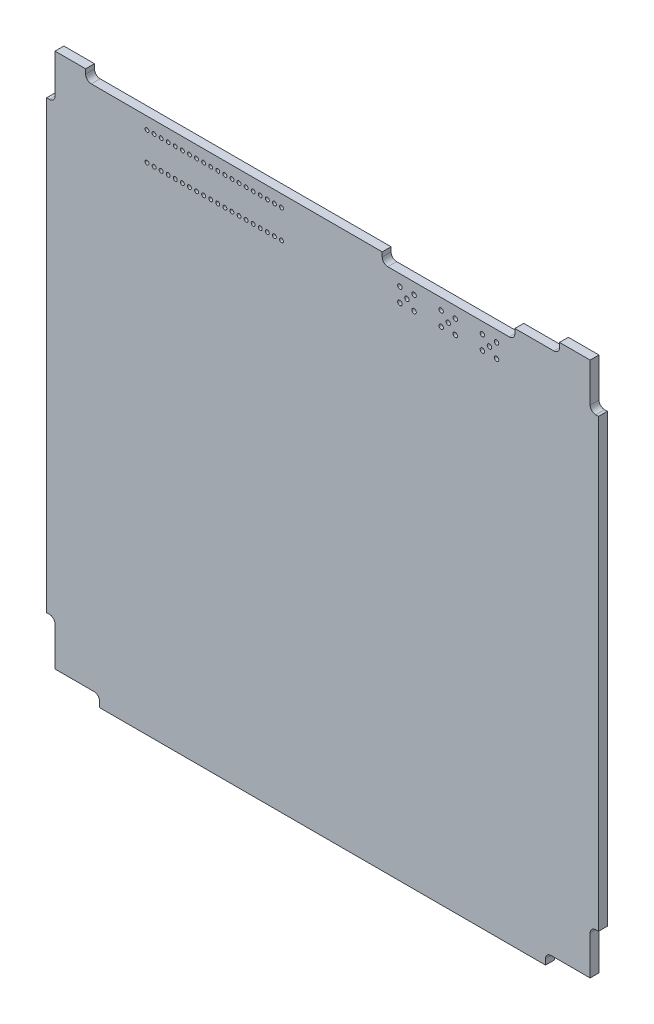
from build123d import *

# Parameters (mm, degrees)
BOSS_EXTRUDE1_DEPTH = 1.5875
SKETCH2_R           = 0.35
CUT_EXTRUDE1_DEPTH  = 71.728496069
CUT_EXTRUDE2_DEPTH  = 5.6475
FILLET2_R           = 1
SKETCH5_OUTSIDE_W   = 130.286
SKETCH5_OUTSIDE_H   = 130.286
SKETCH5_OUTSIDE_W_2 = 99
SKETCH5_OUTSIDE_H_2 = 100
CUT_EXTRUDE3_DEPTH  = 71.728496069
SKETCH8_W           = 85
SKETCH8_H           = 1.5875
CUT_EXTRUDE4_DEPTH  = 3.8375
FILLET1_R           = 1
SKETCH6_R           = 0.4
CUT_EXTRUDE5_DEPTH  = 71.375920287


with BuildPart() as part:
    # Sketch1 → Boss-Extrude1 (new body)
    with BuildSketch(Plane.XY):
        Polygon((40, 50), (-40, 50), (-40, 48), (-48, 48), (-48, 40), (-50, 40), (-50, -37.864895224), (-50, -40), (-48, -40), (-48, -48), (-40, -48), (-40, -50), (-37.864895224, -50), (40, -50), (40, -48), (48, -48), (48, -40), (50, -40), (50, 40), (48, 40), (48, 48), (40, 48), align=None)
    extrude(amount=BOSS_EXTRUDE1_DEPTH)

    # Sketch2 → Cut-Extrude1 (cut, through all)
    with BuildSketch(Plane.XY.offset(1.5875)):
        with Locations((-31.5, 44)):
            Circle(SKETCH2_R)
        with Locations((-30.23, 44)):
            Circle(SKETCH2_R)
        with Locations((-28.96, 44)):
            Circle(SKETCH2_R)
        with Locations((-27.69, 44)):
            Circle(SKETCH2_R)
        with Locations((-26.42, 44)):
            Circle(SKETCH2_R)
        with Locations((-25.15, 44)):
            Circle(SKETCH2_R)
        with Locations((-23.88, 44)):
            Circle(SKETCH2_R)
        with Locations((-22.61, 44)):
            Circle(SKETCH2_R)
        with Locations((-21.34, 44)):
            Circle(SKETCH2_R)
        with Locations((-20.07, 44)):
            Circle(SKETCH2_R)
        with Locations((-18.8, 44)):
            Circle(SKETCH2_R)
        with Locations((-17.53, 44)):
            Circle(SKETCH2_R)
        with Locations((-16.26, 44)):
            Circle(SKETCH2_R)
        with Locations((-14.99, 44)):
            Circle(SKETCH2_R)
        with Locations((-13.72, 44)):
            Circle(SKETCH2_R)
        with Locations((-12.45, 44)):
            Circle(SKETCH2_R)
        with Locations((-11.18, 44)):
            Circle(SKETCH2_R)
        with Locations((-9.91, 44)):
            Circle(SKETCH2_R)
        with Locations((-8.64, 44)):
            Circle(SKETCH2_R)
        with Locations((-7.37, 44)):
            Circle(SKETCH2_R)
        with Locations((-30.23, 38.92)):
            Circle(SKETCH2_R)
        with Locations((-28.96, 38.92)):
            Circle(SKETCH2_R)
        with Locations((-27.69, 38.92)):
            Circle(SKETCH2_R)
        with Locations((-26.42, 38.92)):
            Circle(SKETCH2_R)
        with Locations((-25.15, 38.92)):
            Circle(SKETCH2_R)
        with Locations((-23.88, 38.92)):
            Circle(SKETCH2_R)
        with Locations((-22.61, 38.92)):
            Circle(SKETCH2_R)
        with Locations((-21.34, 38.92)):
            Circle(SKETCH2_R)
        with Locations((-20.07, 38.92)):
            Circle(SKETCH2_R)
        with Locations((-18.8, 38.92)):
            Circle(SKETCH2_R)
        with Locations((-17.53, 38.92)):
            Circle(SKETCH2_R)
        with Locations((-16.26, 38.92)):
            Circle(SKETCH2_R)
        with Locations((-14.99, 38.92)):
            Circle(SKETCH2_R)
        with Locations((-13.72, 38.92)):
            Circle(SKETCH2_R)
        with Locations((-12.45, 38.92)):
            Circle(SKETCH2_R)
        with Locations((-11.18, 38.92)):
            Circle(SKETCH2_R)
        with Locations((-9.91, 38.92)):
            Circle(SKETCH2_R)
        with Locations((-8.64, 38.92)):
            Circle(SKETCH2_R)
        with Locations((-7.37, 38.92)):
            Circle(SKETCH2_R)
        with Locations((-31.5, 38.92)):
            Circle(SKETCH2_R)
    extrude(amount=-CUT_EXTRUDE1_DEPTH, mode=Mode.SUBTRACT)

    # Sketch3 → Cut-Extrude2 (cut)
    with BuildSketch(Plane(origin=(0, 50, 0), x_dir=(1, 0, 0), z_dir=(0, 1, 0))):
        Polygon((10.7, 0), (19.7, 0), (34.5, 0), (34.5, -1.5875), (19.7, -1.5875), (10.7, -1.5875), align=None)
    extrude(amount=-CUT_EXTRUDE2_DEPTH, mode=Mode.SUBTRACT)

    # Fillet2
    fillet2_edges = [part.edges().sort_by_distance(p)[0] for p in [
        (10.7, 44.3525, 0.79375),
        (34.5, 44.3525, 0.79375),
    ]]
    fillet(fillet2_edges, radius=FILLET2_R)

    # Sketch5 outside → Cut-Extrude3 (cut, through all)
    with BuildSketch(Plane(origin=(0, 0, 0), x_dir=(-1, 0, 0), z_dir=(0, 0, -1))):
        Rectangle(SKETCH5_OUTSIDE_W, SKETCH5_OUTSIDE_H)
        Rectangle(SKETCH5_OUTSIDE_W_2, SKETCH5_OUTSIDE_H_2, mode=Mode.SUBTRACT)
    extrude(amount=-CUT_EXTRUDE3_DEPTH, mode=Mode.SUBTRACT)

    # Sketch8 → Cut-Extrude4 (cut)
    with BuildSketch(Plane(origin=(0, 50, 0), x_dir=(1, 0, 0), z_dir=(0, 1, 0))):
        with Locations((0, -0.79375)):
            Rectangle(SKETCH8_W, SKETCH8_H)
    extrude(amount=-CUT_EXTRUDE4_DEPTH, mode=Mode.SUBTRACT)

    # Fillet1
    fillet1_edges = [part.edges().sort_by_distance(p)[0] for p in [
        (-48, -40, 0.79375),
        (-40, -48, 0.79375),
        (40, -48, 0.79375),
        (48, -40, 0.79375),
        (48, 40, 0.79375),
        (-48, 40, 0.79375),
        (42.5, 46.1625, 0.79375),
        (-42.5, 46.1625, 0.79375),
    ]]
    fillet(fillet1_edges, radius=FILLET1_R)

    # Sketch6 → Cut-Extrude5 (cut, through all)
    with BuildSketch(Plane.XY.offset(1.5875)):
        with Locations((29.94, 41.0825)):
            Circle(SKETCH6_R)
        with Locations((28.67, 42.3525)):
            Circle(SKETCH6_R)
        with Locations((31.21, 42.3525)):
            Circle(SKETCH6_R)
        with Locations((31.21, 39.8125)):
            Circle(SKETCH6_R)
        with Locations((28.67, 39.8125)):
            Circle(SKETCH6_R)
        with Locations((22.54, 41.0825)):
            Circle(SKETCH6_R)
        with Locations((21.27, 42.3525)):
            Circle(SKETCH6_R)
        with Locations((23.81, 42.3525)):
            Circle(SKETCH6_R)
        with Locations((23.81, 39.8125)):
            Circle(SKETCH6_R)
        with Locations((21.27, 39.8125)):
            Circle(SKETCH6_R)
        with Locations((15.14, 41.0825)):
            Circle(SKETCH6_R)
        with Locations((13.87, 42.3525)):
            Circle(SKETCH6_R)
        with Locations((16.41, 42.3525)):
            Circle(SKETCH6_R)
        with Locations((16.41, 39.8125)):
            Circle(SKETCH6_R)
        with Locations((13.87, 39.8125)):
            Circle(SKETCH6_R)
    extrude(amount=-CUT_EXTRUDE5_DEPTH, mode=Mode.SUBTRACT)


solid = part.part
